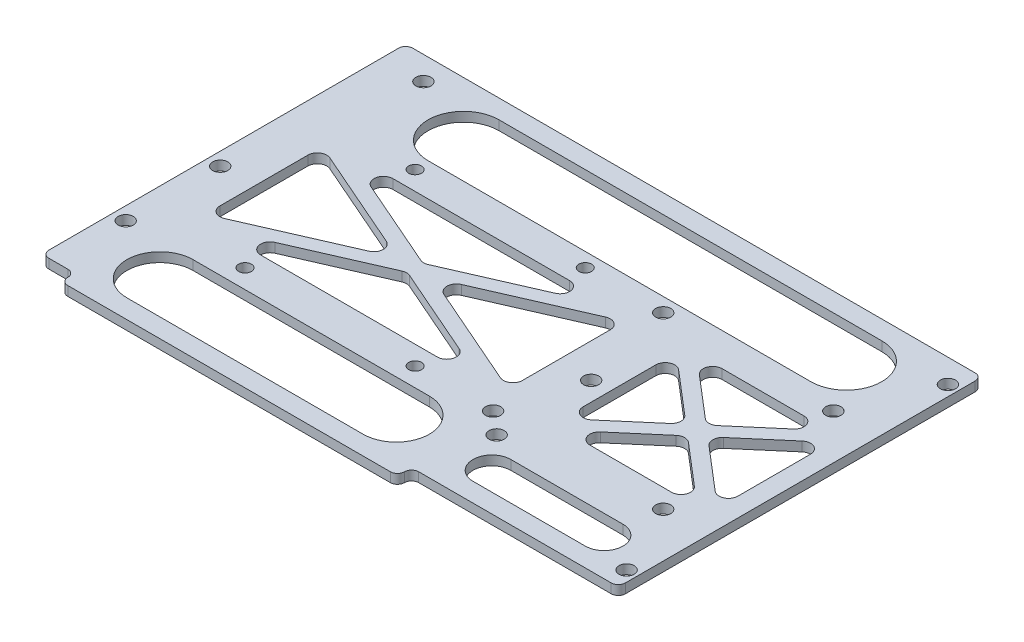
from build123d import *

# Parameters (mm, degrees)
SKETCH_1_W          = 100
SKETCH_1_H          = 80
SKETCH_1_R          = 1.35
EXTRUDE_1_DEPTH     = 2
SKETCH_2_W          = 8
SKETCH_2_H          = 80
CUT_EXTRUDE_1_DEPTH = 5
SKETCH_3_R          = 1.6
CUT_EXTRUDE_2_DEPTH = 5
SKETCH_4_W          = 30
SKETCH_4_H          = 80
EXTRUDE_2_DEPTH     = 2
SKETCH_5_R          = 1.6
CUT_EXTRUDE_3_DEPTH = 2
SKETCH_6_W          = 43.75
SKETCH_6_H          = 3
SKETCH_6_W_2        = 7
CUT_EXTRUDE_4_DEPTH = 10
SKETCH_8_R          = 1.6
CUT_EXTRUDE_5_DEPTH = 10
SKETCH_7_W          = 64
SKETCH_7_H          = 28
SKETCH_7_W_2        = 32.75
CUT_EXTRUDE_6_DEPTH = 10
EXTRUDE_1_2_DEPTH   = 2
FILLET_1_R          = 2
FILLET_2_R          = 1.5


with BuildPart() as part:
    # 草图1 → Extrude 1 (new body)
    with BuildSketch(Plane(origin=(0, 0, 0), x_dir=(1, 0, 0), z_dir=(0, 1, 0))):
        Rectangle(SKETCH_1_W, SKETCH_1_H)
        with Locations(Location((18, -18, 0), (0, 0, 270))):
            Circle(SKETCH_1_R, mode=Mode.SUBTRACT)
        with Locations(Location((-18, -18, 0), (0, 0, 270))):
            Circle(SKETCH_1_R, mode=Mode.SUBTRACT)
        with Locations(Location((-18, 18, 0), (0, 0, 270))):
            Circle(SKETCH_1_R, mode=Mode.SUBTRACT)
        with Locations(Location((18, 18, 0), (0, 0, 270))):
            Circle(SKETCH_1_R, mode=Mode.SUBTRACT)
    extrude(amount=EXTRUDE_1_DEPTH)

    # 草图2 → 切除-拉伸1 (cut)
    with BuildSketch(Plane(origin=(0, 2, 0), x_dir=(1, 0, 0), z_dir=(0, 1, 0))):
        with Locations((-46, 0)):
            Rectangle(SKETCH_2_W, SKETCH_2_H)
    extrude(amount=-CUT_EXTRUDE_1_DEPTH, mode=Mode.SUBTRACT)

    # 草图3 → 切除-拉伸2 (cut)
    with BuildSketch(Plane(origin=(0, 2, 0), x_dir=(1, 0, 0), z_dir=(0, 1, 0))):
        with Locations(Location((-39.25, -22, 0), (0, 0, 270))):
            Circle(SKETCH_3_R)
        with Locations(Location((-39.25, -2, 0), (0, 0, 270))):
            Circle(SKETCH_3_R)
        with Locations(Location((39.25, -22, 0), (0, 0, 270))):
            Circle(SKETCH_3_R)
        with Locations(Location((39.25, -2, 0), (0, 0, 270))):
            Circle(SKETCH_3_R)
    extrude(amount=-CUT_EXTRUDE_2_DEPTH, mode=Mode.SUBTRACT)

    # 草图4 → 凸台-拉伸2 (add)
    with BuildSketch(Plane(origin=(0, 2, 0), x_dir=(1, 0, 0), z_dir=(0, 1, 0))):
        with Locations((65, 0)):
            Rectangle(SKETCH_4_W, SKETCH_4_H)
    extrude(amount=-EXTRUDE_2_DEPTH)

    # 草图5 → 切除-拉伸3 (cut)
    with BuildSketch(Plane(origin=(0, 2, 0), x_dir=(1, 0, 0), z_dir=(0, 1, 0))):
        with Locations(Location((34.5, -18, 0), (0, 0, 270))):
            Circle(SKETCH_5_R)
        with Locations(Location((70.5, -18, 0), (0, 0, 270))):
            Circle(SKETCH_5_R)
        with Locations(Location((70.5, 18, 0), (0, 0, 270))):
            Circle(SKETCH_5_R)
        with Locations(Location((34.5, 18, 0), (0, 0, 270))):
            Circle(SKETCH_5_R)
    extrude(amount=-CUT_EXTRUDE_3_DEPTH, mode=Mode.SUBTRACT)

    # 草图6 → 切除-拉伸4 (cut)
    with BuildSketch(Plane(origin=(0, 2, 0), x_dir=(1, 0, 0), z_dir=(0, 1, 0))):
        with Locations((58.125, -38.5)):
            Rectangle(SKETCH_6_W, SKETCH_6_H)
        with Locations((-38.5, -38.5)):
            Rectangle(SKETCH_6_W_2, SKETCH_6_H)
    extrude(amount=-CUT_EXTRUDE_4_DEPTH, mode=Mode.SUBTRACT)

    # 草图8 → 切除-拉伸5 (cut)
    with BuildSketch(Plane(origin=(0, 2, 0), x_dir=(1, 0, 0), z_dir=(0, 1, 0))):
        with Locations(Location((77.75, -33, 0), (0, 0, 270))):
            Circle(SKETCH_8_R)
        with Locations(Location((77.75, 35, 0), (0, 0, 270))):
            Circle(SKETCH_8_R)
        with Locations(Location((-33.25, 35, 0), (0, 0, 270))):
            Circle(SKETCH_8_R)
    extrude(amount=-CUT_EXTRUDE_5_DEPTH, mode=Mode.SUBTRACT)

    # 草图7 → 切除-拉伸6 (cut)
    with BuildSketch(Plane(origin=(0, 2, 0), x_dir=(1, 0, 0), z_dir=(0, 1, 0))):
        with BuildLine():
            Line((-25, -22), (25, -22))
            ThreePointArc((25, -22), (32, -29), (25, -36))
            Line((25, -36), (-25, -36))
            ThreePointArc((-25, -36), (-32, -29), (-25, -22))
        make_face()
        with BuildLine():
            Line((45.25, -25), (69, -25))
            ThreePointArc((69, -25), (73, -29), (69, -33))
            Line((69, -33), (45.25, -33))
            ThreePointArc((45.25, -33), (41.25, -29), (45.25, -25))
        make_face()
        Rectangle(SKETCH_7_W, SKETCH_7_H)
        with Locations((59.625, 0)):
            Rectangle(SKETCH_7_W_2, SKETCH_7_H)
        with BuildLine():
            Line((-18.25, 36), (62.75, 36))
            ThreePointArc((62.75, 36), (70.25, 28.5), (62.75, 21))
            Line((62.75, 21), (-18.25, 21))
            ThreePointArc((-18.25, 21), (-25.75, 28.5), (-18.25, 36))
        make_face()
    extrude(amount=-CUT_EXTRUDE_6_DEPTH, mode=Mode.SUBTRACT)

    # 草图9 → Extrude 1 2 (add)
    with BuildSketch(Plane(origin=(0, 2, 0), x_dir=(1, 0, 0), z_dir=(0, 1, 0))):
        Polygon((32.601228251, -12.625763998), (-31.398771749, 15.374236002), (-32.601228251, 12.625763998), (31.398771749, -15.374236002), align=None)
        Polygon((-31.398771749, -15.374236002), (32.601228251, 12.625763998), (31.398771749, 15.374236002), (-32.601228251, -12.625763998), align=None)
        Polygon((42.275247173, 12.859887319), (75.025247173, -15.140112681), (76.974752827, -12.859887319), (44.224752827, 15.140112681), align=None)
        Polygon((44.224752827, -15.140112681), (76.974752827, 12.859887319), (75.025247173, 15.140112681), (42.275247173, -12.859887319), align=None)
    extrude(amount=-EXTRUDE_1_2_DEPTH)

    # 圆角1
    fillet_1_edges = [part.edges().sort_by_distance(p)[0] for p in [
        (28.257660886, 1, -14),
        (-28.257660886, 1, -14),
        (-32, 1, 12.362726638),
        (-32, 1, -12.362726638),
        (-28.257660886, 1, 14),
        (28.257660886, 1, 14),
        (32, 1, -12.362726638),
        (32, 1, 12.362726638),
        (3.742339114, 1, 0),
        (0, 1, 1.637273362),
        (-3.742339114, 1, 0),
        (0, 1, -1.637273362),
        (45.558277481, 1, 14),
        (73.691722519, 1, 14),
        (76, 1, -12.026510856),
        (76, 1, 12.026510856),
        (73.691722519, 1, -14),
        (45.558277481, 1, -14),
        (43.25, 1, 12.026510856),
        (43.25, 1, -12.026510856),
        (57.316722519, 1, 0),
        (59.625, 1, -1.973489144),
        (61.933277481, 1, 0),
        (59.625, 1, 1.973489144),
    ]]
    fillet(fillet_1_edges, radius=FILLET_1_R)

    # 圆角2
    fillet_2_edges = [part.edges().sort_by_distance(p)[0] for p in [
        (80, 1, 37),
        (80, 1, -40),
        (-42, 1, -40),
        (-42, 1, 37),
        (-35, 1, 37),
        (-35, 1, 40),
        (36.25, 1, 37),
        (36.25, 1, 40),
    ]]
    fillet(fillet_2_edges, radius=FILLET_2_R - 0.0001)  # a hair under: the kernel refuses the full size


solid = part.part
